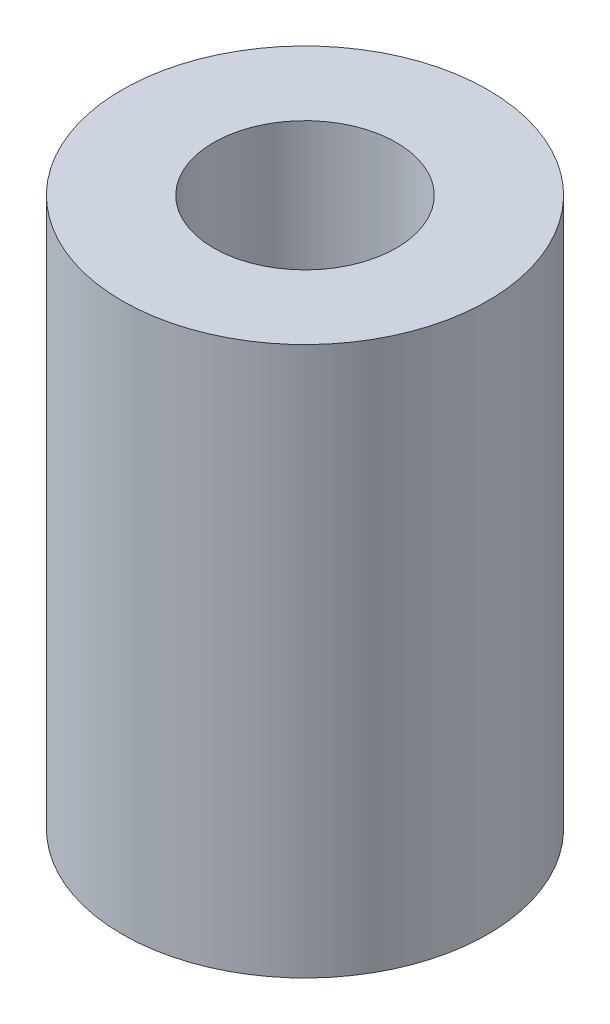
from build123d import *

# Parameters (mm, degrees)
SKETCH1_R           = 5
SKETCH1_R_2         = 2.5
BOSS_EXTRUDE1_DEPTH = 15


with BuildPart() as part:
    # Sketch1 → Boss-Extrude1 (new body)
    with BuildSketch(Plane(origin=(0, 0, 0), x_dir=(1, 0, 0), z_dir=(0, 1, 0))):
        Circle(SKETCH1_R)
        Circle(SKETCH1_R_2, mode=Mode.SUBTRACT)
    extrude(amount=BOSS_EXTRUDE1_DEPTH)


solid = part.part
